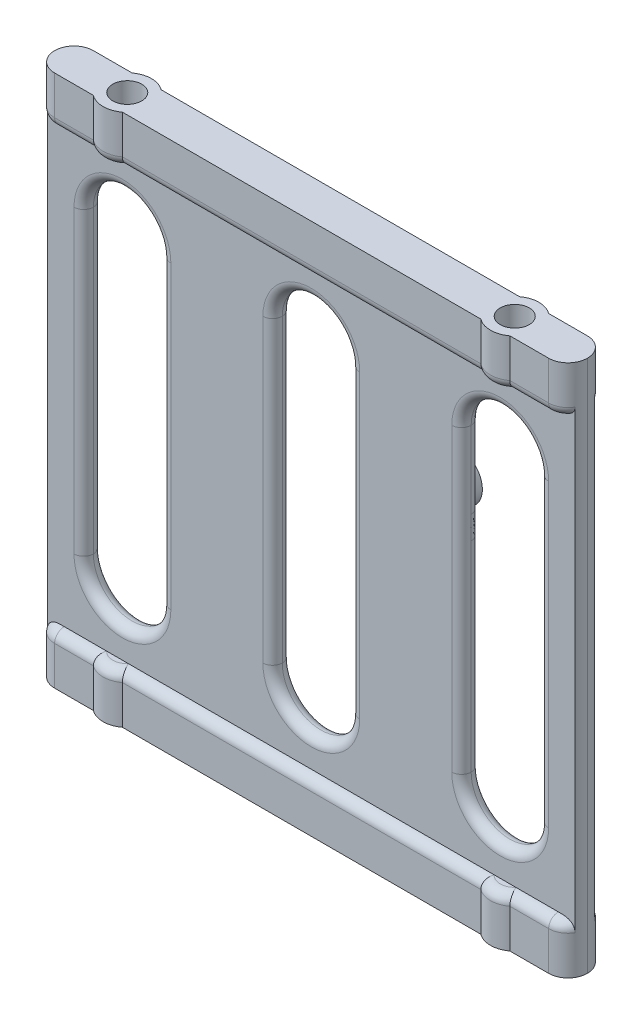
from build123d import *

# Parameters (mm, degrees)
BOSS_EXTRUDE1_DEPTH     = 55
SKETCH2_R               = 1.5000000000000007
CUT_EXTRUDE1_DEPTH      = 2.8
CUT_EXTRUDE2_START      = -2.8
SKETCH3_R               = 1.5000000000000007
CUT_EXTRUDE2_DEPTH      = 2.8
CUT_EXTRUDE3_DEPTH      = 5
CUT_EXTRUDE3_DEPTH_BACK = 1
CUT_EXTRUDE4_DEPTH      = 1
CUT_EXTRUDE4_DEPTH_BACK = 1
FILLET1_R               = 2
FILLET2_R               = 1
SKETCH6_R               = 2.500000000000001
BOSS_EXTRUDE2_DEPTH     = 3
FILLET3_R               = 2
SKETCH7_R               = 1.5000000000000024
CUT_EXTRUDE5_DEPTH      = 3
CUT_EXTRUDE6_DEPTH      = 2
FILLET4_R               = 1


with BuildPart() as part:
    # Sketch1 → Boss-Extrude1 (new body)
    with BuildSketch(Plane(origin=(0, 0, 0), x_dir=(1, 0, 0), z_dir=(0, 1, 0))):
        with BuildLine():
            Line((-18.500000000000032, 1.9999999999999996), (-21.500000000000068, 1.9999999999999996))
            ThreePointArc((-21.500000000000053, 1.9999999999999463), (-22.499999999999986, -1.91e-15), (-21.50000000000005, -1.9999999999999476))
            Line((-21.500000000000064, -2.0000000000000004), (-18.500000000000036, -2.0000000000000004))
            ThreePointArc((-18.50000000000003, -2.0000000000000226), (-17.763932022500214, -1.1180339887499129), (-17.499999999999993, -6.1e-16))
            ThreePointArc((-17.499999999999993, 0), (-17.763932022500214, 1.1180339887499113), (-18.500000000000025, 2.0000000000000213))
        make_face()
        with BuildLine():
            ThreePointArc((-18.500000000000025, 2.000000000000021), (-20.00000000000005, 2.4999999999999947), (-21.500000000000053, 1.9999999999999463))
            Line((-21.500000000000068, 1.9999999999999996), (-18.500000000000032, 1.9999999999999996))
        make_face()
        with BuildLine():
            Line((-18.500000000000036, -2.0000000000000004), (-21.500000000000064, -2.0000000000000004))
            ThreePointArc((-21.50000000000005, -1.9999999999999476), (-20.000000000000053, -2.4999999999999947), (-18.50000000000003, -2.0000000000000226))
        make_face()
        with BuildLine():
            Line((-21.500000000000068, 1.9999999999999996), (-27.49999999999999, 1.9999999999999996))
            Line((-27.49999999999999, 1.9999999999999996), (-27.49999999999999, -2.0000000000000004))
            Line((-27.49999999999999, -2.0000000000000004), (-21.500000000000064, -2.0000000000000004))
            ThreePointArc((-21.50000000000005, -1.9999999999999476), (-22.499999999999986, -1.91e-15), (-21.500000000000053, 1.9999999999999463))
        make_face()
        with BuildLine():
            Line((18.49999999999991, 1.9999999999999996), (-18.500000000000032, 1.9999999999999996))
            ThreePointArc((-18.500000000000025, 2.0000000000000213), (-17.763932022500214, 1.1180339887499113), (-17.499999999999993, 0))
            ThreePointArc((-17.499999999999993, -6.1e-16), (-17.763932022500214, -1.1180339887499129), (-18.50000000000003, -2.0000000000000226))
            Line((-18.500000000000036, -2.0000000000000004), (18.499999999999925, -2.0000000000000004))
            ThreePointArc((18.499999999999932, -1.9999999999999478), (17.5, -1.91e-15), (18.49999999999993, 1.9999999999999456))
        make_face()
        with BuildLine():
            ThreePointArc((21.49999999999997, 2.00000000000002), (19.99999999999994, 2.4999999999999982), (18.49999999999993, 1.9999999999999456))
            Line((18.49999999999991, 1.9999999999999996), (21.499999999999968, 1.9999999999999996))
        make_face()
        with BuildLine():
            Line((21.499999999999968, 1.9999999999999996), (18.49999999999991, 1.9999999999999996))
            ThreePointArc((18.49999999999993, 1.9999999999999456), (17.5, -1.91e-15), (18.499999999999932, -1.9999999999999478))
            Line((18.49999999999992, -2.0000000000000004), (21.499999999999954, -2.0000000000000004))
            ThreePointArc((21.499999999999964, -2.0000000000000244), (22.23606797749978, -1.1180339887499124), (22.5, -6.1e-16))
            ThreePointArc((22.5, 0), (22.23606797749978, 1.11803398874991), (21.49999999999997, 2.00000000000002))
        make_face()
        with BuildLine():
            Line((21.499999999999954, -2.0000000000000004), (18.49999999999992, -2.0000000000000004))
            ThreePointArc((18.499999999999932, -1.9999999999999478), (19.999999999999936, -2.4999999999999982), (21.499999999999964, -2.0000000000000244))
        make_face()
        with BuildLine():
            Line((27.50000000000001, 1.9999999999999996), (21.499999999999968, 1.9999999999999996))
            ThreePointArc((21.49999999999997, 2.00000000000002), (22.23606797749978, 1.11803398874991), (22.5, 0))
            ThreePointArc((22.5, -6.1e-16), (22.23606797749978, -1.1180339887499124), (21.499999999999964, -2.0000000000000244))
            Line((21.499999999999954, -2.0000000000000004), (27.50000000000001, -2.0000000000000004))
            Line((27.50000000000001, -2.0000000000000004), (27.50000000000001, 1.9999999999999996))
        make_face()
    extrude(amount=BOSS_EXTRUDE1_DEPTH)

    # Sketch2 → Cut-Extrude1 (cut)
    with BuildSketch(Plane(origin=(0, 55, 0), x_dir=(1, 0, 0), z_dir=(0, 1, 0))):
        with Locations(Location((-19.99999999999999, 0, 0), (0, 0, 270))):
            Circle(SKETCH2_R)
        with Locations(Location((20, 0, 0), (0, 0, 270))):
            Circle(SKETCH2_R)
    extrude(amount=-CUT_EXTRUDE1_DEPTH, mode=Mode.SUBTRACT)

    # Sketch3 → Cut-Extrude2 (cut)
    with BuildSketch(Plane.XZ.offset(CUT_EXTRUDE2_START)):
        with Locations(Location((-19.99999999999999, 0, 0), (0, 0, 90))):
            Circle(SKETCH3_R)
        with Locations(Location((20, 0, 0), (0, 0, 90))):
            Circle(SKETCH3_R)
    extrude(amount=CUT_EXTRUDE2_DEPTH, mode=Mode.SUBTRACT)

    # Sketch4 → Cut-Extrude3 (cut, two sides: drawn at the far end of the back side and taken through both)
    with BuildSketch(Plane.XY.offset(2.0000000000000004).offset(-CUT_EXTRUDE3_DEPTH_BACK)):
        Polygon((-27.500000000000018, 50), (27.500000000000007, 50), (27.50000000000001, 5.000000000000008), (-27.50000000000001, 5.000000000000008), align=None)
    extrude(amount=CUT_EXTRUDE3_DEPTH + CUT_EXTRUDE3_DEPTH_BACK, mode=Mode.SUBTRACT)

    # Sketch5 → Cut-Extrude4 (cut, two sides: drawn at the far end of the back side and taken through both)
    with BuildSketch(Plane(origin=(0, 0, -1.9999999999999996), x_dir=(-1, 0, 0), z_dir=(0, 0, -1)).offset(-CUT_EXTRUDE4_DEPTH_BACK)):
        Polygon((-27.49999999999999, 50), (27.49999999999999, 50), (27.499999999999986, 5.000000000000001), (-27.49999999999998, 5.000000000000001), align=None)
    extrude(amount=CUT_EXTRUDE4_DEPTH + CUT_EXTRUDE4_DEPTH_BACK, mode=Mode.SUBTRACT)

    # Fillet1
    fillet1_edges = [part.edges().sort_by_distance(p)[0] for p in [
        (-27.49999999999999, 52.5, 2.0000000000000004),
    ]]
    fillet(fillet1_edges, radius=FILLET1_R)
    fillet1_2_edges = [part.edges().sort_by_distance(p)[0] for p in [
        (-27.49999999999999, 2.5000000000000004, -1.9999999999999996),
    ]]
    fillet(fillet1_2_edges, radius=FILLET1_R - 0.0004)  # a hair under: the kernel refuses the full size
    fillet1_3_edges = [part.edges().sort_by_distance(p)[0] for p in [
        (27.50000000000001, 52.5, 2.0000000000000004),
    ]]
    fillet(fillet1_3_edges, radius=FILLET1_R)
    fillet1_4_edges = [part.edges().sort_by_distance(p)[0] for p in [
        (27.50000000000001, 2.5000000000000004, -1.9999999999999996),
    ]]
    fillet(fillet1_4_edges, radius=FILLET1_R - 0.0004)  # a hair under: the kernel refuses the full size

    # Fillet2
    fillet2_edges = [part.edges().sort_by_distance(p)[0] for p in [
        (-19.999999999999986, 50, -2.499999999999992),
        (19.999999999999996, 50, -2.500000000000009),
        (19.999999999999996, 5.000000000000001, -2.500000000000009),
        (-19.999999999999986, 5.000000000000001, -2.499999999999992),
        (-5.684e-14, 50, -1.9999999999999996),
        (23.500199999999992, 5.000000000000001, -1.9999999999999996),
        (-5.151e-14, 5.000000000000001, -1.9999999999999996),
        (23.500200169244646, 50, -1.9999999999999996),
        (-26.5002999949995, 50, -1.7320466614179624),
        (26.50030014156478, 50, -1.7320465767871778),
        (-23.500200000000024, 5.000000000000001, -1.9999999999999996),
        (-26.50029999499948, 5.000000000000001, -1.7320466614179733),
        (26.500299994999555, 5.000000000000001, -1.732046661417944),
        (-23.500000000000025, 5.000000000000008, 2.0000000000000004),
        (-26.49999999999999, 5.000000000000007, 1.7320508075688776),
        (26.500000103238282, 5.000000000000007, 1.7320507479642298),
        (23.499999999999982, 50, 2.0000000000000004),
        (-26.499999999999982, 50, 1.7320508075688823),
        (26.50000000000001, 50, 1.732050807568878),
        (-20.000000000000053, 50, 2.4999999999999925),
        (-23.50000000000002, 50, 2.0000000000000004),
        (19.999999999999932, 50, 2.499999999999999),
        (-5.329e-14, 50, 2.0000000000000004),
        (-20.000000000000053, 5.000000000000008, 2.4999999999999925),
        (-5.507e-14, 5.000000000000008, 2.0000000000000004),
        (19.999999999999932, 5.000000000000008, 2.499999999999999),
        (23.500000119209272, 5.000000000000008, 2.0000000000000004),
        (-23.500200000000024, 50, -1.9999999999999996),
    ]]
    fillet(fillet2_edges, radius=FILLET2_R - 0.0001)  # a hair under: the kernel refuses the full size

    # Sketch6 → Boss-Extrude2 (add)
    with BuildSketch(Plane(origin=(0, 0, -0.9999999999999996), x_dir=(-1, 0, 0), z_dir=(0, 0, -1))):
        with Locations((10.159999999999997, 33.85000000000001)):
            Circle(SKETCH6_R)
        with Locations((-10.160000000000004, 33.85000000000001)):
            Circle(SKETCH6_R)
    extrude(amount=BOSS_EXTRUDE2_DEPTH)

    # Fillet3
    fillet3_edges = [part.edges().sort_by_distance(p)[0] for p in [
        (-7.659999999999996, 33.85000000000001, -0.9999999999999996),
        (12.660000000000004, 33.85000000000001, -0.9999999999999996),
    ]]
    fillet(fillet3_edges, radius=FILLET3_R)

    # Sketch7 → Cut-Extrude5 (cut)
    with BuildSketch(Plane(origin=(0, 0, -4), x_dir=(-1, 0, 0), z_dir=(0, 0, -1))):
        with Locations((-10.160000000000004, 33.85000000000001)):
            Circle(SKETCH7_R)
        with Locations((10.159999999999997, 33.85000000000001)):
            Circle(SKETCH7_R)
    extrude(amount=-CUT_EXTRUDE5_DEPTH, mode=Mode.SUBTRACT)

    # Sketch8 → Cut-Extrude6 (cut)
    with BuildSketch(Plane(origin=(0, 0, -0.9999999999999996), x_dir=(-1, 0, 0), z_dir=(0, 0, -1))):
        with BuildLine():
            Line((-15.500000000000007, 43), (-15.500000000000004, 12))
            ThreePointArc((-15.500000000000004, 12), (-19.500000000000007, 7.9999999999999964), (-23.50000000000001, 11.999999999999998))
            Line((-23.50000000000001, 11.999999999999998), (-23.500000000000014, 43))
            ThreePointArc((-23.500000000000014, 43), (-19.500000000000007, 47), (-15.500000000000007, 43))
        make_face()
        with BuildLine():
            Line((23.49999999999999, 43), (23.49999999999999, 12))
            ThreePointArc((23.49999999999999, 12), (19.499999999999993, 8.000000000000004), (15.499999999999996, 11.999999999999998))
            Line((15.499999999999996, 11.999999999999998), (15.49999999999999, 43))
            ThreePointArc((15.49999999999999, 43), (19.49999999999999, 47), (23.49999999999999, 43))
        make_face()
        with BuildLine():
            Line((3.999999999999988, 43), (3.9999999999999973, 12.000000000000004))
            ThreePointArc((3.9999999999999973, 12.000000000000004), (-3.91e-15, 8), (-4.000000000000008, 12.000000000000002))
            Line((-4.000000000000008, 12.000000000000002), (-4.000000000000018, 43))
            ThreePointArc((-4.000000000000018, 43), (-1.429e-14, 47), (3.999999999999988, 43))
        make_face()
    extrude(amount=-CUT_EXTRUDE6_DEPTH, mode=Mode.SUBTRACT)

    # Fillet4
    fillet4_edges = [part.edges().sort_by_distance(p)[0] for p in [
        (19.500000000000007, 7.999999999999996, 1.0000000000000004),
        (23.500000000000014, 27.5, 1.0000000000000004),
        (19.50000000000001, 47, 1.0000000000000004),
        (4.08e-15, 7.999999999999999, 1.0000000000000004),
        (4.000000000000012, 27.5, 1.0000000000000004),
        (1.479e-14, 47, 1.0000000000000004),
        (-19.499999999999993, 8.000000000000005, 1.0000000000000004),
        (-15.499999999999993, 27.5, 1.0000000000000004),
        (-19.49999999999999, 47, 1.0000000000000004),
        (-19.499999999999993, 8.000000000000005, -0.9999999999999996),
        (-15.499999999999993, 27.5, -0.9999999999999996),
        (-19.49999999999999, 47, -0.9999999999999996),
        (4.08e-15, 7.999999999999999, -0.9999999999999996),
        (4.000000000000012, 27.5, -0.9999999999999996),
        (1.479e-14, 47, -0.9999999999999996),
        (19.500000000000007, 7.999999999999996, -0.9999999999999996),
        (23.500000000000014, 27.5, -0.9999999999999996),
        (19.50000000000001, 47, -0.9999999999999996),
        (15.500000000000005, 27.5, 1.0000000000000004),
        (-3.999999999999993, 27.5, 1.0000000000000004),
        (-23.49999999999999, 27.5, 1.0000000000000004),
        (-23.49999999999999, 27.5, -0.9999999999999996),
        (-3.999999999999993, 27.5, -0.9999999999999996),
        (15.500000000000005, 27.5, -0.9999999999999996),
    ]]
    fillet(fillet4_edges, radius=FILLET4_R - 0.0001)  # a hair under: the kernel refuses the full size


solid = part.part
